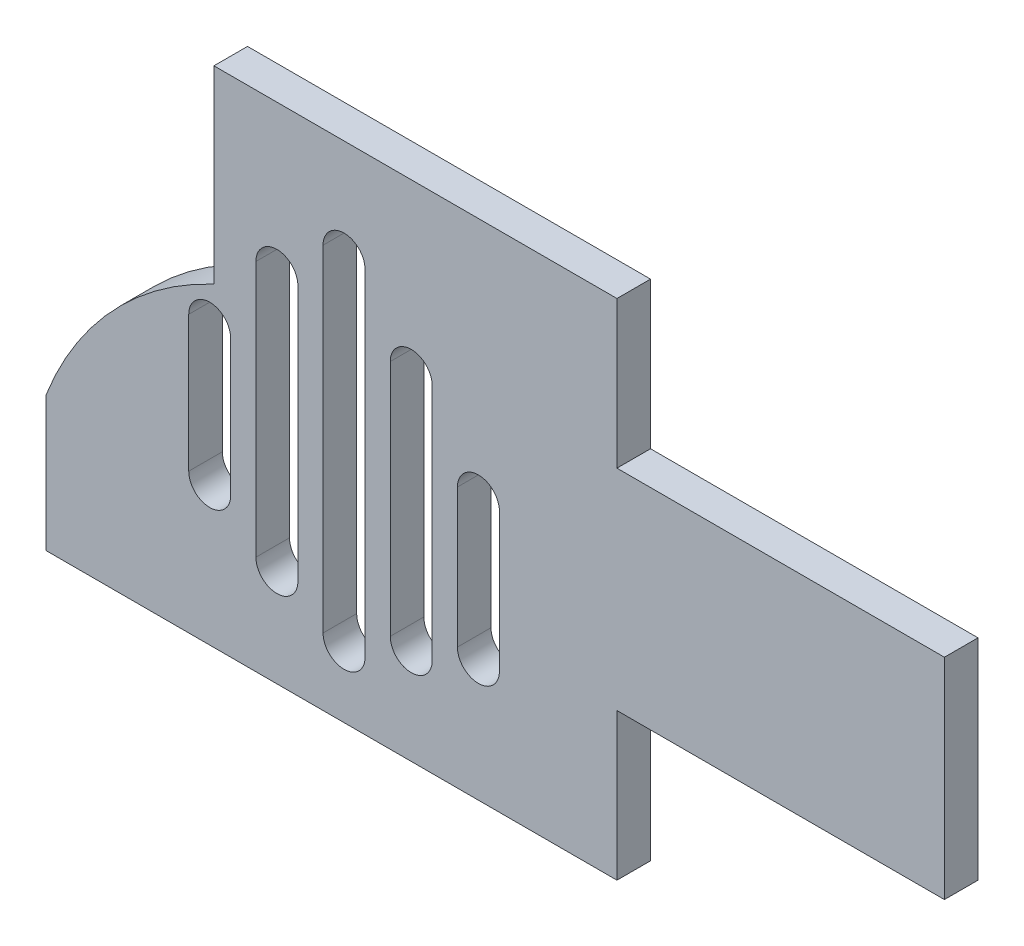
from build123d import *

# Parameters (mm, degrees)
BOSS_EXTRUDE1_DEPTH = 4


with BuildPart() as part:
    # Sketch1 → Boss-Extrude1 (new body)
    with BuildSketch(Plane.XY):
        with BuildLine():
            Line((30.862718171, 33.494054131), (69.862718171, 33.494054131))
            Line((69.862718171, 33.494054131), (69.862718171, 8.494054131))
            Line((69.862718171, 8.494054131), (30.862718171, 8.494054131))
            Line((30.862718171, 8.494054131), (30.862718171, -9.005945869))
            Line((30.862718171, -9.005945869), (-37.137281829, -9.005945869))
            Line((-37.137281829, -9.005945869), (-37.137281829, 7.037446143))
            ThreePointArc((-37.137281829, 7.037446143), (-29.213438657, 19.692053402), (-17.137281829, 28.472304637))
            Line((-17.137281829, 28.472304637), (-17.137281829, 50.994054131))
            Line((-17.137281829, 50.994054131), (30.862718171, 50.994054131))
            Line((30.862718171, 50.994054131), (30.862718171, 33.494054131))
        make_face()
        with BuildLine():
            Line((-4.137281829, 38.994054131), (-4.137281829, -1.005945869))
            ThreePointArc((-4.137281829, -1.005945869), (-1.637281829, -3.505945869), (0.862718171, -1.005945869))
            Line((0.862718171, -1.005945869), (0.862718171, 38.994054131))
            ThreePointArc((0.862718171, 38.994054131), (-1.637281829, 41.494054131), (-4.137281829, 38.994054131))
        make_face(mode=Mode.SUBTRACT)
        with BuildLine():
            Line((-12.137281829, 33.312431903), (-12.137281829, 2.809827896))
            ThreePointArc((-12.137281829, 2.809827896), (-9.637281829, 0.309827896), (-7.137281829, 2.809827896))
            Line((-7.137281829, 2.809827896), (-7.137281829, 33.312431903))
            ThreePointArc((-7.137281829, 33.312431903), (-9.637281829, 35.812431903), (-12.137281829, 33.312431903))
        make_face(mode=Mode.SUBTRACT)
        with BuildLine():
            Line((-15.137281829, 23.861283589), (-15.137281829, 7.683449462))
            ThreePointArc((-15.137281829, 7.683449462), (-17.637281829, 5.183449462), (-20.137281829, 7.683449462))
            Line((-20.137281829, 7.683449462), (-20.137281829, 23.861283589))
            ThreePointArc((-20.137281829, 23.861283589), (-17.637281829, 26.361283589), (-15.137281829, 23.861283589))
        make_face(mode=Mode.SUBTRACT)
        with BuildLine():
            Line((3.862718171, 30.994054131), (3.862718171, 2.647434443))
            ThreePointArc((3.862718171, 2.647434443), (6.362718171, 0.147434443), (8.862718171, 2.647434443))
            Line((8.862718171, 2.647434443), (8.862718171, 30.994054131))
            ThreePointArc((8.862718171, 30.994054131), (6.362718171, 33.494054131), (3.862718171, 30.994054131))
        make_face(mode=Mode.SUBTRACT)
        with BuildLine():
            Line((11.862718171, 22.048271006), (11.862718171, 5.538473012))
            ThreePointArc((11.862718171, 5.538473012), (14.362718171, 3.038473012), (16.862718171, 5.538473012))
            Line((16.862718171, 5.538473012), (16.862718171, 22.048271006))
            ThreePointArc((16.862718171, 22.048271006), (14.362718171, 24.548271006), (11.862718171, 22.048271006))
        make_face(mode=Mode.SUBTRACT)
    extrude(amount=BOSS_EXTRUDE1_DEPTH)


solid = part.part
